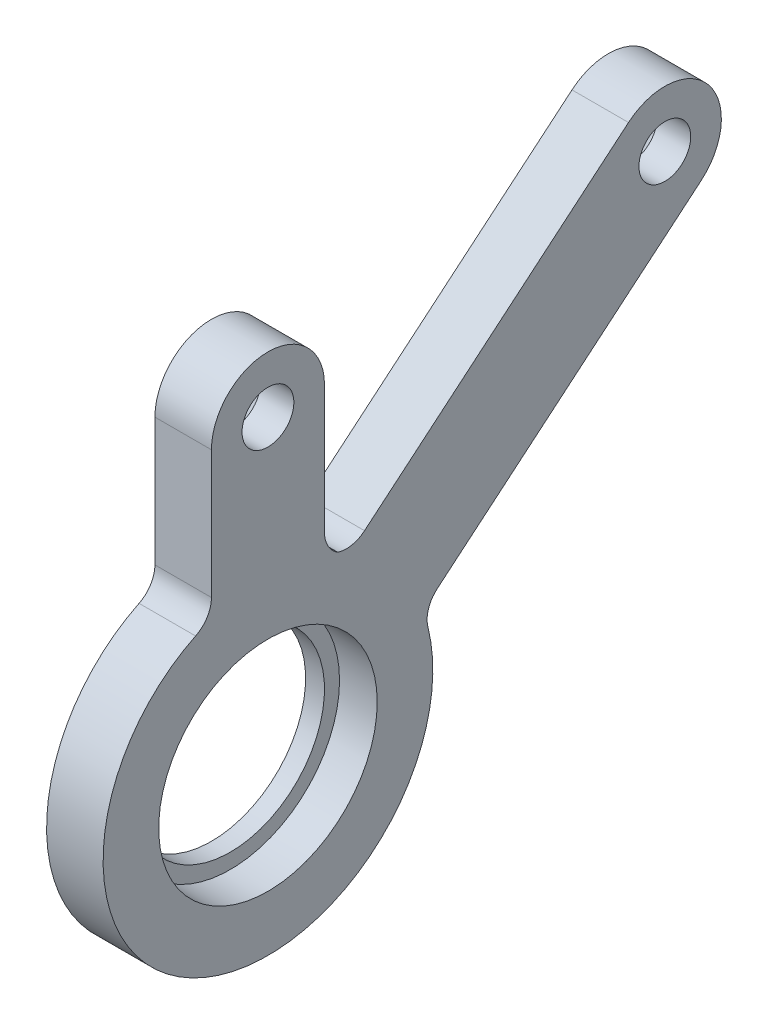
from build123d import *

# Parameters (mm, degrees)
BOSS_EXTRUDE1_DEPTH                                 = 4
BOSS_EXTRUDE1_DEPTH_BACK                            = 2
SKETCH1_R                                           = 17.5
SKETCH1_R_2                                         = 11.6
BOSS_EXTRUDE2_DEPTH                                 = 6
CSK_FOR_M5_COUNTERSUNK_FLAT_HEAD_SCREW2_D           = 5.5
CSK_FOR_M5_COUNTERSUNK_FLAT_HEAD_SCREW2_CSINK_D     = 10.4
CSK_FOR_M5_COUNTERSUNK_FLAT_HEAD_SCREW2_CSINK_ANGLE = 90
FILLET1_R                                           = 3
SKETCH5_R                                           = 11.6
SKETCH5_R_2                                         = 10
BOSS_EXTRUDE3_DEPTH                                 = 2


with BuildPart() as part:
    # Sketch1 → Boss-Extrude1 (new, two sides: drawn at the far end of the back side and taken through both)
    with BuildSketch(Plane(origin=(0, 0, 0), x_dir=(0, 0, -1), z_dir=(1, 0, 0)).offset(-BOSS_EXTRUDE1_DEPTH_BACK)):
        Circle(SKETCH1_R)
        Circle(SKETCH1_R_2, mode=Mode.SUBTRACT)
    extrude(amount=BOSS_EXTRUDE1_DEPTH + BOSS_EXTRUDE1_DEPTH_BACK)

    # Sketch2 → Boss-Extrude2 (add)
    with BuildSketch(Plane.ZY.offset(2)):
        with BuildLine():
            Line((-8.736495138, 15.163233584), (-38.275718713, 39.949585191))
            ThreePointArc((-38.275718713, 39.949585191), (-46.72871103, 39.210044191), (-45.98917003, 30.757051874))
            Line((-45.98917003, 30.757051874), (-16.449946454, 5.970700266))
            ThreePointArc((-16.449946454, 5.970700266), (-15.159340579, 8.743248436), (-13.405777755, 11.24878317))
            ThreePointArc((-13.405777755, 11.24878317), (-11.242810713, 13.410786975), (-8.736495138, 15.163233584))
        make_face()
        with BuildLine():
            Line((-6, 32), (-6, 16.439282223))
            ThreePointArc((-6, 16.439282223), (-3.046519416, 17.232780375), (0, 17.5))
            ThreePointArc((0, 17.5), (3.046519416, 17.232780375), (6, 16.439282223))
            Line((6, 16.439282223), (6, 32))
            ThreePointArc((6, 32), (0, 38), (-6, 32))
        make_face()
    extrude(amount=-BOSS_EXTRUDE2_DEPTH)

    # CSK for M5 Countersunk Flat Head Screw2 (through all)
    with Locations(Plane.ZY.offset(2)):
        with Locations((0, 32), (-42.132444372, 35.353318533)):
            CounterSinkHole(CSK_FOR_M5_COUNTERSUNK_FLAT_HEAD_SCREW2_D / 2, CSK_FOR_M5_COUNTERSUNK_FLAT_HEAD_SCREW2_CSINK_D / 2, counter_sink_angle=CSK_FOR_M5_COUNTERSUNK_FLAT_HEAD_SCREW2_CSINK_ANGLE)

    # Fillet1
    # the kernel refuses this fillet: 3 mm, written as the material it adds along each edge
    with BuildSketch(Plane(origin=(-2, 5.970700266, -16.449946454), x_dir=(0, -0.9565409410444833, -0.2915980591597522), z_dir=(1, 0, 0)), Plane(origin=(4, 15.163233584, -8.736495138), x_dir=(0, 0.45326962070001187, 0.8913734632299009), z_dir=(-1, 0, 0)), Plane(origin=(-2, 16.439282223, -6), x_dir=(0, -0.3914755922176966, -0.9201884919394524), z_dir=(1, 0, 0)), Plane(origin=(4, 16.439282223, 6), x_dir=(0, -0.39147559221769407, 0.9201884919394534), z_dir=(-1, 0, 0))) as fillet1_piece_1:
        with BuildLine():
            CenterArc((1.985655892, 2.995901464), FILLET1_R, 203.046346261, 63.958350044)
            Line((-0.774909584, 1.821474687), (0, 0))
            ThreePointArc((0, 0), (0.914446792, 0.02390813), (1.828893584, 0))
        make_face()
    extrude(amount=6)

    # Sketch5 → Boss-Extrude3 (add)
    with BuildSketch(Plane.ZY.offset(2)):
        with Locations(Location((0, 0, 0), (0, 0, 180))):
            Circle(SKETCH5_R)
        Circle(SKETCH5_R_2, mode=Mode.SUBTRACT)
    extrude(amount=-BOSS_EXTRUDE3_DEPTH)


solid = part.part
